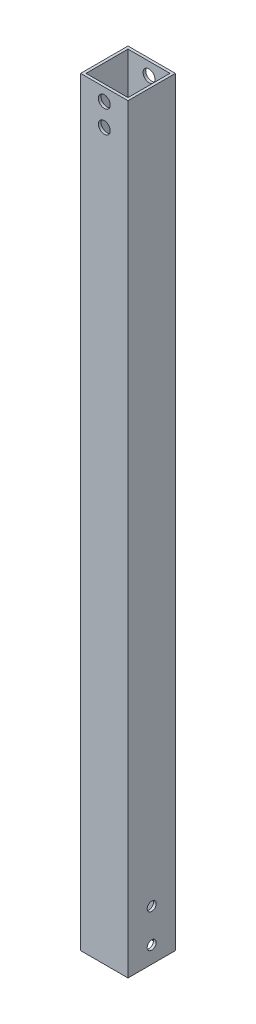
from build123d import *

# Parameters (mm, degrees)
SKETCH1_W               = 26.924
SKETCH1_H               = 26.924
SKETCH1_W_2             = 23.876
SKETCH1_H_2             = 23.876
EXTRUDE_THIN1_DEPTH     = 431.8
F_1_4_CLEARANCE_HOLE1_D = 6.7564
F_10_CLEARANCE_HOLE1_D  = 5.1054


with BuildPart() as part:
    # Sketch1 → Extrude-Thin1 (new body)
    with BuildSketch(Plane(origin=(0, 0, 0), x_dir=(1, 0, 0), z_dir=(0, 1, 0))):
        Rectangle(SKETCH1_W, SKETCH1_H)
        Rectangle(SKETCH1_W_2, SKETCH1_H_2, mode=Mode.SUBTRACT)
    extrude(amount=EXTRUDE_THIN1_DEPTH)

    # 1/4 Clearance Hole1 (through all)
    with Locations(Plane(origin=(0, 0, -13.462), x_dir=(-1, 0, 0), z_dir=(0, 0, -1))):
        with Locations((0, 424.6245), (0, 411.9245)):
            Hole(F_1_4_CLEARANCE_HOLE1_D / 2)

    # #10 Clearance Hole1 (through all)
    with Locations(Plane(origin=(13.462, 0, 0), x_dir=(0, 0, -1), z_dir=(1, 0, 0))):
        with Locations((0, 9.525), (0, 28.575)):
            Hole(F_10_CLEARANCE_HOLE1_D / 2)


solid = part.part
